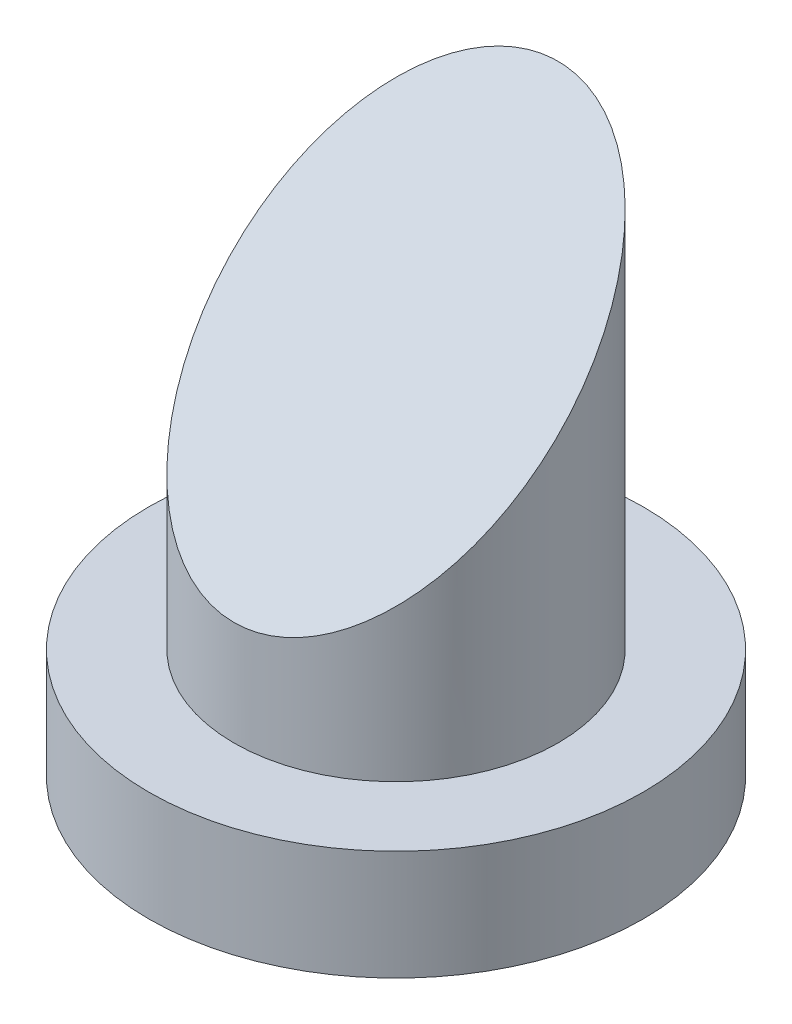
from build123d import *

# Parameters (mm, degrees)
SKETCH1_R               = 9
BOSS_EXTRUDE1_DEPTH     = 4
SKETCH2_R               = 5.9
BOSS_EXTRUDE2_DEPTH     = 20
CUT_EXTRUDE1_DEPTH      = 28.166155414
CUT_EXTRUDE1_DEPTH_BACK = 28.166155414
SKETCH4_R               = 0.425
CUT_EXTRUDE2_DEPTH      = 1.5


with BuildPart() as part:
    # Sketch1 → Boss-Extrude1 (new body)
    with BuildSketch(Plane(origin=(0, 0, 0), x_dir=(1, 0, 0), z_dir=(0, 1, 0))):
        Circle(SKETCH1_R)
    extrude(amount=BOSS_EXTRUDE1_DEPTH)

    # Sketch2 → Boss-Extrude2 (add)
    with BuildSketch(Plane(origin=(0, 4, 0), x_dir=(1, 0, 0), z_dir=(0, 1, 0))):
        Circle(SKETCH2_R)
    extrude(amount=BOSS_EXTRUDE2_DEPTH)

    # Sketch3 → Cut-Extrude1 (cut, two sides: drawn at the far end of the back side and taken through both)
    with BuildSketch(Plane(origin=(0, 0, 0), x_dir=(0, 0, -1), z_dir=(1, 0, 0)).offset(-CUT_EXTRUDE1_DEPTH_BACK)):
        Polygon((-6.28, 28.771900514), (-6.28, 7.42), (6.28, 19.98), (6.28, 28.771900514), align=None)
    extrude(amount=CUT_EXTRUDE1_DEPTH + CUT_EXTRUDE1_DEPTH_BACK, mode=Mode.SUBTRACT)

    # Sketch4 → Cut-Extrude2 (cut)
    with BuildSketch(Plane.XZ):
        with Locations((0, -6)):
            Circle(SKETCH4_R)
    extrude(amount=-CUT_EXTRUDE2_DEPTH, mode=Mode.SUBTRACT)


solid = part.part
